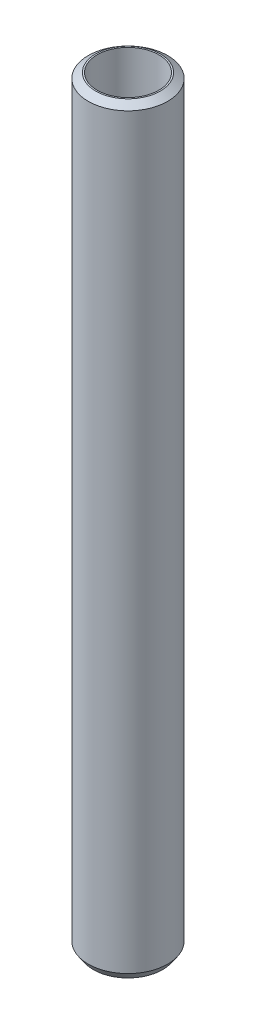
from build123d import *
from OCP.BRepFilletAPI import BRepFilletAPI_MakeChamfer

# Parameters (mm, degrees)
SKETCH1_R           = 30
BOSS_EXTRUDE1_DEPTH = 573.796063695
SKETCH2_R           = 23.250051083
CUT_EXTRUDE1_DEPTH  = 576.362427268
CHAMFER1_SIZE       = 3.883985307
CHAMFER1_SIZE2      = 5.627573166


with BuildPart() as part:
    # Sketch1 → Boss-Extrude1 (new body)
    with BuildSketch(Plane(origin=(0, 0, 0), x_dir=(1, 0, 0), z_dir=(0, 1, 0))):
        Circle(SKETCH1_R)
    extrude(amount=BOSS_EXTRUDE1_DEPTH)

    # Sketch2 → Cut-Extrude1 (cut, through all)
    with BuildSketch(Plane(origin=(0, 0, 0), x_dir=(1, 0, 0), z_dir=(0, 1, 0))):
        Circle(SKETCH2_R)
    extrude(amount=CUT_EXTRUDE1_DEPTH, mode=Mode.SUBTRACT)

    # Chamfer1: one chamfer whose edges measure the first distance from different faces: ONE call of the kernel's chamfer builder (chamfer() names one face for all edges)
    chamfer1_edges_1 = [part.edges().sort_by_distance(p)[0] for p in [
        (-30, 573.796063695, 0),
    ]]
    chamfer1_side_1 = [part.faces().sort_by_distance(p)[0] for p in [
        (-30, 286.898031847, 0),
    ]]
    chamfer1_edges_2 = [part.edges().sort_by_distance(p)[0] for p in [
        (-30, 0, 0),
    ]]
    chamfer1_side_2 = [part.faces().sort_by_distance(p)[0] for p in [
        (-29.151471863, 0, 0),
    ]]
    chamfer1 = BRepFilletAPI_MakeChamfer(part.part.solid().wrapped)
    for e in chamfer1_edges_1:
        chamfer1.Add(CHAMFER1_SIZE, CHAMFER1_SIZE2, e.wrapped, chamfer1_side_1[0].wrapped)  # the first distance lies on this face
    for e in chamfer1_edges_2:
        chamfer1.Add(CHAMFER1_SIZE, CHAMFER1_SIZE2, e.wrapped, chamfer1_side_2[0].wrapped)  # the first distance lies on this face
    add(Compound.cast(chamfer1.Shape()), mode=Mode.REPLACE)


solid = part.part
